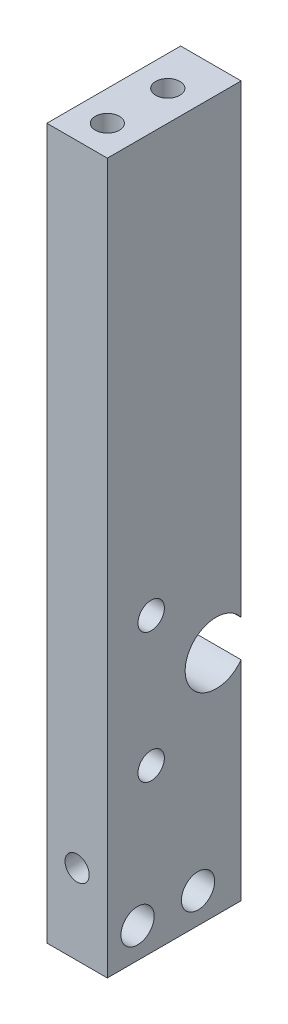
from build123d import *

# Parameters (mm, degrees)
MAIN_STOCK_START                  = 2.248090434
SKETCH_1_W                        = 4
SKETCH_1_H                        = 46.98
MAIN_STOCK_DEPTH                  = 8.851909566
SKETCH_2_R                        = 0.8
FRAME_1XD1P6_THROUGH_DEPTH        = 44.799871038
SKETCH_3_R                        = 2.05
SMA_CENTER_D4P1_DEPTH             = 4
SKETCH_4_R                        = 0.875
SMA_UPPER_2XD1P75_THROUGH_DEPTH   = 45.280835584
SKETCH_5_R                        = 1.1
CORNER_FRONT_2XD2P2_THROUGH_DEPTH = 45.280835584
SKETCH_6_R                        = 0.8
CORNER_REAR_2XD1P6_BLIND4_DEPTH   = 4


with BuildPart() as part:
    # 草图1 → Main_Stock (new body)
    with BuildSketch(Plane.XY.offset(MAIN_STOCK_START)):
        with Locations((-2.3, 19.19)):
            Rectangle(SKETCH_1_W, SKETCH_1_H)
    extrude(amount=MAIN_STOCK_DEPTH)

    # 草图2 → Frame_1xD1p6_Through (cut, through all)
    with BuildSketch(Plane.XY.offset(11.1)):
        with Locations((-2.3, 1)):
            Circle(SKETCH_2_R)
    extrude(amount=-FRAME_1XD1P6_THROUGH_DEPTH, mode=Mode.SUBTRACT)

    # 草图3 → SMA_Center_D4p1 (cut)
    with BuildSketch(Plane.ZY.offset(4.3)):
        with Locations((3.899496327, 10.725)):
            Circle(SKETCH_3_R)
    extrude(amount=-SMA_CENTER_D4P1_DEPTH, mode=Mode.SUBTRACT)

    # 草图4 → SMA_Upper_2xD1p75_Through (cut, through all)
    with BuildSketch(Plane.ZY.offset(4.3)):
        with Locations((8.199496327, 6.425)):
            Circle(SKETCH_4_R)
        with Locations((8.199496327, 15.025)):
            Circle(SKETCH_4_R)
    extrude(amount=-SMA_UPPER_2XD1P75_THROUGH_DEPTH, mode=Mode.SUBTRACT)

    # 草图5 → Corner_Front_2xD2p2_Through (cut, through all)
    with BuildSketch(Plane.ZY.offset(4.3)):
        with Locations((5.1, -2.3)):
            Circle(SKETCH_5_R)
        with Locations((9.1, -2.3)):
            Circle(SKETCH_5_R)
    extrude(amount=-CORNER_FRONT_2XD2P2_THROUGH_DEPTH, mode=Mode.SUBTRACT)

    # 草图6 → Corner_Rear_2xD1p6_Blind4 (cut)
    with BuildSketch(Plane(origin=(0, 42.68, 0), x_dir=(1, 0, 0), z_dir=(0, 1, 0))):
        with Locations((-2.3, -5.1)):
            Circle(SKETCH_6_R)
        with Locations((-2.3, -9.1)):
            Circle(SKETCH_6_R)
    extrude(amount=-CORNER_REAR_2XD1P6_BLIND4_DEPTH, mode=Mode.SUBTRACT)


solid = part.part
